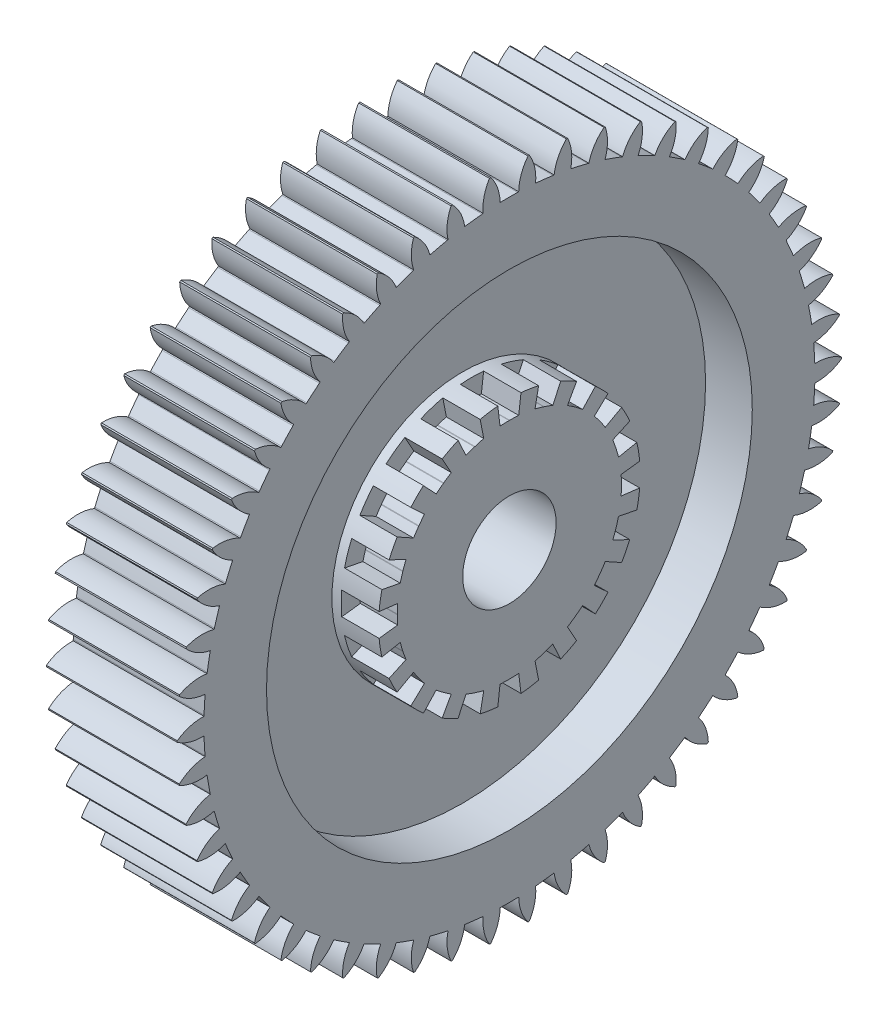
from build123d import *

# Parameters (mm, degrees)
SKETCH1_R                = 177.8
BOSS_EXTRUDE1_DEPTH      = 35
SKETCH2_R                = 25
CUT_EXTRUDE1_DEPTH       = 262.008965363
SKETCH3_R                = 130
SKETCH3_R_2              = 70
CUT_EXTRUDE2_DEPTH       = 25
CUT_EXTRUDE3_DEPTH       = 262.008965363
FILLET1_R                = 290
CIRPATTERN2_COUNT        = 54
FILLET1_OF_CIRPATTERN2_R = 290
CUT_EXTRUDE4_DEPTH       = 20
FILLET2_R                = 70
CIRPATTERN3_START        = 15
CIRPATTERN3_DEPTH        = 20


# Read off the part's stored shape, not the designer's step: CirPattern3
with BuildPart() as part:
    # Sketch1 → Boss-Extrude1 (new, symmetric)
    with BuildSketch(Plane(origin=(0, 0, 0), x_dir=(0, 0, -1), z_dir=(1, 0, 0))):
        Circle(SKETCH1_R)
    extrude(amount=BOSS_EXTRUDE1_DEPTH, both=True)

    # Sketch2 → Cut-Extrude1 (cut, through all)
    with BuildSketch(Plane(origin=(35, 0, 0), x_dir=(0, 0, -1), z_dir=(1, 0, 0))):
        Circle(SKETCH2_R)
    extrude(amount=-CUT_EXTRUDE1_DEPTH, mode=Mode.SUBTRACT)

    # Sketch3 → Cut-Extrude2 (cut)
    with BuildSketch(Plane(origin=(35, 0, 0), x_dir=(0, 0, -1), z_dir=(1, 0, 0))):
        Circle(SKETCH3_R)
        Circle(SKETCH3_R_2, mode=Mode.SUBTRACT)
    extrude(amount=-CUT_EXTRUDE2_DEPTH, mode=Mode.SUBTRACT)

    # Sketch5 → Cut-Extrude3 (cut, through all)
    with BuildSketch(Plane(origin=(35, 0, 0), x_dir=(0, 0, -1), z_dir=(1, 0, 0))):
        with BuildLine():
            Line((0, 163.515), (-4.985, 163.438994735))
            ThreePointArc((-4.985, 163.438994735), (-6.324568609, 170.888942334), (-9.975, 177.519968947))
            Line((-9.975, 177.519968947), (0, 181.540723368))
            Line((0, 181.540723368), (9.975, 177.519968947))
            ThreePointArc((9.975, 177.519968947), (6.324568609, 170.888942334), (4.985, 163.438994735))
            Line((4.985, 163.438994735), (0, 163.515))
        make_face()
    cut_extrude3 = extrude(amount=-CUT_EXTRUDE3_DEPTH, mode=Mode.SUBTRACT)

    # Fillet1
    # the kernel refuses this fillet: 290 mm, written as the material it takes off along each edge
    with BuildSketch(Plane(origin=(46.053925195, 163.515, 0), x_dir=(0, -0.015245021510603718, 0.9998837879069453), z_dir=(-1, 0, 0))) as fillet1_piece_1:
        with BuildLine():
            CenterArc((FILLET1_R * 0.0152467933724, -FILLET1_R), FILLET1_R, 90, 1.747018458)
            Line((-FILLET1_R * 0.0152397063371, -FILLET1_R * 0.000464821361718), (0, 0))
            Line((0, 0), (FILLET1_R * 0.0152467933724, 0))
        make_face()
    extrude(amount=92.10785039, mode=Mode.SUBTRACT)

    # CirPattern2: Cut-Extrude3 ×54 about axis
    cirpattern2_axis = Axis((0, 0, 0), (1, 0, 0))
    for i in range(1, CIRPATTERN2_COUNT):
        add(cut_extrude3.rotate(cirpattern2_axis, i * 360 / CIRPATTERN2_COUNT), mode=Mode.SUBTRACT)

    # Fillet1 of CirPattern2
    # the kernel refuses this fillet: 290 mm, written as the material it takes off along each edge
    with BuildSketch(Plane(origin=(46.053925195, 162.409370066, 18.982932853), x_dir=(0, -0.13122136285363895, 0.9913530924604178), z_dir=(-1, 0, 0)), Plane(origin=(46.053925195, 159.107432013, 37.709154104), x_dir=(0, -0.24542316037219167, 0.96941604708862), z_dir=(-1, 0, 0)), Plane(origin=(46.053925195, 153.653838888, 55.925423736), x_dir=(0, -0.35630603066617983, 0.9343693126975603), z_dir=(-1, 0, 0)), Plane(origin=(46.053925195, 146.122341182, 73.38539795), x_dir=(0, -0.4623704731326896, 0.8866868362477547), z_dir=(-1, 0, 0)), Plane(origin=(46.053925195, 136.614789483, 89.852960549), x_dir=(0, -0.56218214813916, 0.8270134414346841), z_dir=(-1, 0, 0)), Plane(origin=(46.053925195, 125.259757117, 105.105415998), x_dir=(0, -0.654391274006467, 0.7561561085544392), z_dir=(-1, 0, 0)), Plane(origin=(46.053925195, 112.210801416, 118.936501002), x_dir=(0, -0.7377508804905187, 0.6750730614796182), z_dir=(-1, 0, 0)), Plane(origin=(46.053925195, 97.644387122, 131.159173863), x_dir=(0, -0.8111336719156741, 0.5848608093252579), z_dir=(-1, 0, 0)), Plane(origin=(46.053925195, 81.7575, 141.6081439), x_dir=(0, -0.8735472719149304, 0.4867393180440454), z_dir=(-1, 0, 0)), Plane(origin=(46.053925195, 64.764982944, 150.142106717), x_dir=(0, -0.9241476436178044, 0.3820355124797425), z_dir=(-1, 0, 0)), Plane(origin=(46.053925195, 46.896630597, 156.645655106), x_dir=(0, -0.9622505038011333, 0.27216533198492643), z_dir=(-1, 0, 0)), Plane(origin=(46.053925195, 28.394081771, 161.030839734), x_dir=(0, -0.9873405766457838, 0.15861458227026645), z_dir=(-1, 0, 0)), Plane(origin=(46.053925195, 9.507551699, 163.2383585), x_dir=(0, -0.9990785619581524, 0.042918842431153646), z_dir=(-1, 0, 0)), Plane(origin=(46.053925195, -9.507551699, 163.2383585), x_dir=(0, -0.9973057236232107, -0.07335730112527596), z_dir=(-1, 0, 0)), Plane(origin=(46.053925195, -28.394081771, 161.030839734), x_dir=(0, -0.9820460362381654, -0.18864141302722456), z_dir=(-1, 0, 0)), Plane(origin=(46.053925195, -46.896630597, 156.645655106), x_dir=(0, -0.9535058608971471, -0.30137447342930435), z_dir=(-1, 0, 0)), Plane(origin=(46.053925195, -64.764982944, 150.142106717), x_dir=(0, -0.9120711545114353, -0.4100319610813011), z_dir=(-1, 0, 0)), Plane(origin=(46.053925195, -81.7575, 141.6081439), x_dir=(0, -0.8583022504043238, -0.5131444698628969), z_dir=(-1, 0, 0)), Plane(origin=(46.053925195, -97.644387122, 131.159173863), x_dir=(0, -0.7929262807641754, -0.6093175799806633), z_dir=(-1, 0, 0)), Plane(origin=(46.053925195, -112.210801416, 118.936501002), x_dir=(0, -0.7168273434289478, -0.6972507151036831), z_dir=(-1, 0, 0)), Plane(origin=(46.053925195, -125.259757117, 105.105415998), x_dir=(0, -0.6310345459795956, -0.7757547304272954), z_dir=(-1, 0, 0)), Plane(origin=(46.053925195, -136.614789483, 89.852960549), x_dir=(0, -0.5367080888254764, -0.8437679938166087), z_dir=(-1, 0, 0)), Plane(origin=(46.053925195, -146.122341182, 73.38539795), x_dir=(0, -0.43512357548404884, -0.9003707425599617), z_dir=(-1, 0, 0)), Plane(origin=(46.053925195, -153.653838888, 55.925423736), x_dir=(0, -0.32765476223169554, -0.9447975215816833), z_dir=(-1, 0, 0)), Plane(origin=(46.053925195, -159.107432013, 37.709154104), x_dir=(0, -0.21575498040662372, -0.9764475349089358), z_dir=(-1, 0, 0)), Plane(origin=(46.053925195, -162.409370066, 18.982932853), x_dir=(0, -0.10093748259576409, -0.9948927704065548), z_dir=(-1, 0, 0)), Plane(origin=(46.053925195, -163.515, 0), x_dir=(0, 0.015245021510603718, -0.9998837879069453), z_dir=(-1, 0, 0)), Plane(origin=(46.053925195, -162.409370066, -18.982932853), x_dir=(0, 0.13122136285362598, -0.9913530924604195), z_dir=(-1, 0, 0)), Plane(origin=(46.053925195, -159.107432013, -37.709154104), x_dir=(0, 0.24542316037219247, -0.9694160470886198), z_dir=(-1, 0, 0)), Plane(origin=(46.053925195, -153.653838888, -55.925423736), x_dir=(0, 0.35630603066619776, -0.9343693126975535), z_dir=(-1, 0, 0)), Plane(origin=(46.053925195, -146.122341182, -73.38539795), x_dir=(0, 0.46237047313267954, -0.88668683624776), z_dir=(-1, 0, 0)), Plane(origin=(46.053925195, -136.614789483, -89.852960549), x_dir=(0, 0.5621821481391615, -0.827013441434683), z_dir=(-1, 0, 0)), Plane(origin=(46.053925195, -125.259757117, -105.105415998), x_dir=(0, 0.6543912740064689, -0.7561561085544377), z_dir=(-1, 0, 0)), Plane(origin=(46.053925195, -112.210801416, -118.936501002), x_dir=(0, 0.7377508804905157, -0.6750730614796213), z_dir=(-1, 0, 0)), Plane(origin=(46.053925195, -97.644387122, -131.159173863), x_dir=(0, 0.8111336719156761, -0.5848608093252552), z_dir=(-1, 0, 0)), Plane(origin=(46.053925195, -81.7575, -141.6081439), x_dir=(0, 0.8735472719149361, -0.4867393180440357), z_dir=(-1, 0, 0)), Plane(origin=(46.053925195, -64.764982944, -150.142106717), x_dir=(0, 0.9241476436178044, -0.3820355124797425), z_dir=(-1, 0, 0)), Plane(origin=(46.053925195, -46.896630597, -156.645655106), x_dir=(0, 0.9622505038011331, -0.2721653319849268), z_dir=(-1, 0, 0)), Plane(origin=(46.053925195, -28.394081771, -161.030839734), x_dir=(0, 0.9873405766457838, -0.15861458227026634), z_dir=(-1, 0, 0)), Plane(origin=(46.053925195, -9.507551699, -163.2383585), x_dir=(0, 0.9990785619581529, -0.04291884243114078), z_dir=(-1, 0, 0)), Plane(origin=(46.053925195, 9.507551699, -163.2383585), x_dir=(0, 0.9973057236232105, 0.073357301125276), z_dir=(-1, 0, 0)), Plane(origin=(46.053925195, 28.394081771, -161.030839734), x_dir=(0, 0.9820460362381617, 0.18864141302724374), z_dir=(-1, 0, 0)), Plane(origin=(46.053925195, 46.896630597, -156.645655106), x_dir=(0, 0.9535058608971471, 0.30137447342930435), z_dir=(-1, 0, 0)), Plane(origin=(46.053925195, 64.764982944, -150.142106717), x_dir=(0, 0.9120711545114353, 0.4100319610813011), z_dir=(-1, 0, 0)), Plane(origin=(46.053925195, 81.7575, -141.6081439), x_dir=(0, 0.8583022504043184, 0.5131444698629057), z_dir=(-1, 0, 0)), Plane(origin=(46.053925195, 97.644387122, -131.159173863), x_dir=(0, 0.7929262807641698, 0.6093175799806705), z_dir=(-1, 0, 0)), Plane(origin=(46.053925195, 112.210801416, -118.936501002), x_dir=(0, 0.7168273434289478, 0.6972507151036831), z_dir=(-1, 0, 0)), Plane(origin=(46.053925195, 125.259757117, -105.105415998), x_dir=(0, 0.6310345459796027, 0.7757547304272897), z_dir=(-1, 0, 0)), Plane(origin=(46.053925195, 136.614789483, -89.852960549), x_dir=(0, 0.5367080888254628, 0.8437679938166173), z_dir=(-1, 0, 0)), Plane(origin=(46.053925195, 146.122341182, -73.38539795), x_dir=(0, 0.4351235754840476, 0.9003707425599624), z_dir=(-1, 0, 0)), Plane(origin=(46.053925195, 153.653838888, -55.925423736), x_dir=(0, 0.3276547622316945, 0.9447975215816834), z_dir=(-1, 0, 0)), Plane(origin=(46.053925195, 159.107432013, -37.709154104), x_dir=(0, 0.21575498040662336, 0.9764475349089358), z_dir=(-1, 0, 0)), Plane(origin=(46.053925195, 162.409370066, -18.982932853), x_dir=(0, 0.10093748259574493, 0.9948927704065568), z_dir=(-1, 0, 0))) as fillet1_of_cirpattern2_piece_1:
        with BuildLine():
            CenterArc((FILLET1_OF_CIRPATTERN2_R * 0.0152467933724, -FILLET1_OF_CIRPATTERN2_R), FILLET1_OF_CIRPATTERN2_R, 90, 1.747018458)
            Line((-FILLET1_OF_CIRPATTERN2_R * 0.0152397063371, -FILLET1_OF_CIRPATTERN2_R * 0.000464821361718), (0, 0))
            Line((0, 0), (FILLET1_OF_CIRPATTERN2_R * 0.0152467933724, 0))
        make_face()
    extrude(amount=92.10785039, mode=Mode.SUBTRACT)

    # Sketch6 → Cut-Extrude4 (cut)
    with BuildSketch(Plane(origin=(35, 0, 0), x_dir=(0, 0, -1), z_dir=(1, 0, 0))):
        Polygon((0, 59.961257305), (-3.387218626, 59.961257305), (-5, 59.791303716), (-9.571256192, 97.377400695), (9.571256192, 97.377400695), (5, 59.791303716), (3.387218626, 59.961257305), align=None)
    extrude(amount=-CUT_EXTRUDE4_DEPTH, mode=Mode.SUBTRACT)

    # Fillet2
    # the kernel refuses this fillet: 70 mm, written as the material it takes off along each edge
    with BuildSketch(Plane(origin=(43.155288445, 59.961257305, 3.387218626), x_dir=(0, -0.1047989093165836, 0.9944934331638668), z_dir=(-1, 0, 0))) as fillet2_piece_1:
        with BuildLine():
            CenterArc((4.091771331, -69.956406455), FILLET2_R, 92.022191331, 3.993389662)
            Line((-3.244152322, -0.341866134), (-3.390870795, 1.050424673))
            Line((-3.390870795, 1.050424673), (-0.146718473, 1.392290806))
            Line((-0.146718473, 1.392290806), (0, 1.4))
            ThreePointArc((0, 1.4), (0.810855718, 1.4), (1.572310238, 1.399128129))
            Line((1.572310238, 1.399128129), (1.621711436, 0))
        make_face()
    extrude(amount=28.155288445, mode=Mode.SUBTRACT)
    with BuildSketch(Plane(origin=(43.155288445, 59.961257305, -3.387218626), x_dir=(0, 0, 1), z_dir=(-1, 0, 0))) as fillet2_piece_2:
        with BuildLine():
            CenterArc((3.262115378, -70), FILLET2_R, 90, 3.993389662)
            Line((-1.612781374, -0.16995359), (-1.710279309, 1.226647338))
            ThreePointArc((-1.710279309, 1.226647338), (-0.95310916, 1.307314012), (-0.146718473, 1.392290806))
            Line((-0.146718473, 1.392290806), (0, 1.4))
            Line((0, 1.4), (3.262115378, 1.4))
            Line((3.262115378, 1.4), (3.262115378, 0))
        make_face()
    extrude(amount=28.155288445, mode=Mode.SUBTRACT)

    # CirPattern3 outline → CirPattern3 (cut)
    with BuildSketch(Plane.YZ.offset(CIRPATTERN3_START)):
        with BuildLine():
            ThreePointArc((55.319824045, 23.231811545), (56.193793746, 20.954453655), (56.987885455, 18.648027771))
            Line((56.987885455, 18.648027771), (57.065203515, 18.410067252))
            ThreePointArc((57.065203515, 18.410067252), (57.778452948, 16.07737412), (58.409993988, 13.721246382))
            Line((58.409993988, 13.721246382), (68.23001958, 15.641752718))
            ThreePointArc((68.23001958, 15.641752718), (66.573956141, 21.631189606), (64.393236935, 27.450155502))
            Line((64.393236935, 27.450155502), (55.319824045, 23.231811545))
        make_face()
        with BuildLine():
            Line((51.311107083, 31.099361567), (60.057037317, 35.960426426))
            ThreePointArc((60.057037317, 35.960426426), (56.631189606, 41.14496766), (52.759043044, 46.005253799))
            Line((52.759043044, 46.005253799), (45.43325456, 39.189531511))
            ThreePointArc((45.43325456, 39.189531511), (46.968191431, 37.29370694), (48.436142319, 35.345553407))
            Line((48.436142319, 35.345553407), (48.583210009, 35.143132099))
            ThreePointArc((48.583210009, 35.143132099), (49.982392349, 33.145015291), (51.311107083, 31.099361567))
        make_face()
        with BuildLine():
            ThreePointArc((64.393236935, -27.450155502), (66.573956141, -21.631189606), (68.23001958, -15.641752718))
            Line((68.23001958, -15.641752718), (58.409993988, -13.721246382))
            ThreePointArc((58.409993988, -13.721246382), (57.778452948, -16.07737412), (57.065203515, -18.410067252))
            Line((57.065203515, -18.410067252), (56.987885455, -18.648027771))
            ThreePointArc((56.987885455, -18.648027771), (56.193793746, -20.954453655), (55.319824045, -23.231811545))
            Line((55.319824045, -23.231811545), (64.393236935, -27.450155502))
        make_face()
        with BuildLine():
            Line((39.189531511, 45.43325456), (46.005253799, 52.759043044))
            ThreePointArc((46.005253799, 52.759043044), (41.14496766, 56.631189606), (35.960426426, 60.057037317))
            Line((35.960426426, 60.057037317), (31.099361567, 51.311107083))
            ThreePointArc((31.099361567, 51.311107083), (33.145015291, 49.982392349), (35.143132099, 48.583210009))
            Line((35.143132099, 48.583210009), (35.345553407, 48.436142319))
            ThreePointArc((35.345553407, 48.436142319), (37.29370694, 46.968191431), (39.189531511, 45.43325456))
        make_face()
        with BuildLine():
            ThreePointArc((52.759043044, -46.005253799), (56.631189606, -41.14496766), (60.057037317, -35.960426426))
            Line((60.057037317, -35.960426426), (51.311107083, -31.099361567))
            ThreePointArc((51.311107083, -31.099361567), (49.982392349, -33.145015291), (48.583210009, -35.143132099))
            Line((48.583210009, -35.143132099), (48.436142319, -35.345553407))
            ThreePointArc((48.436142319, -35.345553407), (46.968191431, -37.29370694), (45.43325456, -39.189531511))
            Line((45.43325456, -39.189531511), (52.759043044, -46.005253799))
        make_face()
        with BuildLine():
            Line((23.231811545, 55.319824045), (27.450155502, 64.393236935))
            ThreePointArc((27.450155502, 64.393236935), (21.631189606, 66.573956141), (15.641752718, 68.23001958))
            Line((15.641752718, 68.23001958), (13.721246382, 58.409993988))
            ThreePointArc((13.721246382, 58.409993988), (16.07737412, 57.778452948), (18.410067252, 57.065203515))
            Line((18.410067252, 57.065203515), (18.648027771, 56.987885455))
            ThreePointArc((18.648027771, 56.987885455), (20.954453655, 56.193793746), (23.231811545, 55.319824045))
        make_face()
        with BuildLine():
            ThreePointArc((35.960426426, -60.057037317), (41.14496766, -56.631189606), (46.005253799, -52.759043044))
            Line((46.005253799, -52.759043044), (39.189531511, -45.43325456))
            ThreePointArc((39.189531511, -45.43325456), (37.29370694, -46.968191431), (35.345553407, -48.436142319))
            Line((35.345553407, -48.436142319), (35.143132099, -48.583210009))
            ThreePointArc((35.143132099, -48.583210009), (33.145015291, -49.982392349), (31.099361567, -51.311107083))
            Line((31.099361567, -51.311107083), (35.960426426, -60.057037317))
        make_face()
        with BuildLine():
            Line((5, 59.791303716), (6.208044728, 69.72417214))
            ThreePointArc((6.208044728, 69.72417214), (0, 70), (-6.208044728, 69.72417214))
            Line((-6.208044728, 69.72417214), (-5, 59.791303716))
            ThreePointArc((-5, 59.791303716), (-2.564032448, 59.918756005), (-0.125103249, 59.961257305))
            Line((-0.125103249, 59.961257305), (0.125103249, 59.961257305))
            ThreePointArc((0.125103249, 59.961257305), (2.564032448, 59.918756005), (5, 59.791303716))
        make_face()
        with BuildLine():
            ThreePointArc((15.641752718, -68.23001958), (21.631189606, -66.573956141), (27.450155502, -64.393236935))
            Line((27.450155502, -64.393236935), (23.231811545, -55.319824045))
            ThreePointArc((23.231811545, -55.319824045), (20.954453655, -56.193793746), (18.648027771, -56.987885455))
            Line((18.648027771, -56.987885455), (18.410067252, -57.065203515))
            ThreePointArc((18.410067252, -57.065203515), (16.07737412, -57.778452948), (13.721246382, -58.409993988))
            Line((13.721246382, -58.409993988), (15.641752718, -68.23001958))
        make_face()
        with BuildLine():
            Line((-13.721246382, 58.409993988), (-15.641752718, 68.23001958))
            ThreePointArc((-15.641752718, 68.23001958), (-21.631189606, 66.573956141), (-27.450155502, 64.393236935))
            Line((-27.450155502, 64.393236935), (-23.231811545, 55.319824045))
            ThreePointArc((-23.231811545, 55.319824045), (-20.954453655, 56.193793746), (-18.648027771, 56.987885455))
            Line((-18.648027771, 56.987885455), (-18.410067252, 57.065203515))
            ThreePointArc((-18.410067252, 57.065203515), (-16.07737412, 57.778452948), (-13.721246382, 58.409993988))
        make_face()
        with BuildLine():
            ThreePointArc((-6.208044728, -69.72417214), (0, -70), (6.208044728, -69.72417214))
            Line((6.208044728, -69.72417214), (5, -59.791303716))
            ThreePointArc((5, -59.791303716), (2.564032448, -59.918756005), (0.125103249, -59.961257305))
            Line((0.125103249, -59.961257305), (-0.125103249, -59.961257305))
            ThreePointArc((-0.125103249, -59.961257305), (-2.564032448, -59.918756005), (-5, -59.791303716))
            Line((-5, -59.791303716), (-6.208044728, -69.72417214))
        make_face()
        with BuildLine():
            Line((-31.099361567, 51.311107083), (-35.960426426, 60.057037317))
            ThreePointArc((-35.960426426, 60.057037317), (-41.14496766, 56.631189606), (-46.005253799, 52.759043044))
            Line((-46.005253799, 52.759043044), (-39.189531511, 45.43325456))
            ThreePointArc((-39.189531511, 45.43325456), (-37.29370694, 46.968191431), (-35.345553407, 48.436142319))
            Line((-35.345553407, 48.436142319), (-35.143132099, 48.583210009))
            ThreePointArc((-35.143132099, 48.583210009), (-33.145015291, 49.982392349), (-31.099361567, 51.311107083))
        make_face()
        with BuildLine():
            ThreePointArc((-27.450155502, -64.393236935), (-21.631189606, -66.573956141), (-15.641752718, -68.23001958))
            Line((-15.641752718, -68.23001958), (-13.721246382, -58.409993988))
            ThreePointArc((-13.721246382, -58.409993988), (-16.07737412, -57.778452948), (-18.410067252, -57.065203515))
            Line((-18.410067252, -57.065203515), (-18.648027771, -56.987885455))
            ThreePointArc((-18.648027771, -56.987885455), (-20.954453655, -56.193793746), (-23.231811545, -55.319824045))
            Line((-23.231811545, -55.319824045), (-27.450155502, -64.393236935))
        make_face()
        with BuildLine():
            Line((-45.43325456, 39.189531511), (-52.759043044, 46.005253799))
            ThreePointArc((-52.759043044, 46.005253799), (-56.631189606, 41.14496766), (-60.057037317, 35.960426426))
            Line((-60.057037317, 35.960426426), (-51.311107083, 31.099361567))
            ThreePointArc((-51.311107083, 31.099361567), (-49.982392349, 33.145015291), (-48.583210009, 35.143132099))
            Line((-48.583210009, 35.143132099), (-48.436142319, 35.345553407))
            ThreePointArc((-48.436142319, 35.345553407), (-46.968191431, 37.29370694), (-45.43325456, 39.189531511))
        make_face()
        with BuildLine():
            ThreePointArc((-46.005253799, -52.759043044), (-41.14496766, -56.631189606), (-35.960426426, -60.057037317))
            Line((-35.960426426, -60.057037317), (-31.099361567, -51.311107083))
            ThreePointArc((-31.099361567, -51.311107083), (-33.145015291, -49.982392349), (-35.143132099, -48.583210009))
            Line((-35.143132099, -48.583210009), (-35.345553407, -48.436142319))
            ThreePointArc((-35.345553407, -48.436142319), (-37.29370694, -46.968191431), (-39.189531511, -45.43325456))
            Line((-39.189531511, -45.43325456), (-46.005253799, -52.759043044))
        make_face()
        with BuildLine():
            Line((-55.319824045, 23.231811545), (-64.393236935, 27.450155502))
            ThreePointArc((-64.393236935, 27.450155502), (-66.573956141, 21.631189606), (-68.23001958, 15.641752718))
            Line((-68.23001958, 15.641752718), (-58.409993988, 13.721246382))
            ThreePointArc((-58.409993988, 13.721246382), (-57.778452948, 16.07737412), (-57.065203515, 18.410067252))
            Line((-57.065203515, 18.410067252), (-56.987885455, 18.648027771))
            ThreePointArc((-56.987885455, 18.648027771), (-56.193793746, 20.954453655), (-55.319824045, 23.231811545))
        make_face()
        with BuildLine():
            ThreePointArc((-60.057037317, -35.960426426), (-56.631189606, -41.14496766), (-52.759043044, -46.005253799))
            Line((-52.759043044, -46.005253799), (-45.43325456, -39.189531511))
            ThreePointArc((-45.43325456, -39.189531511), (-46.968191431, -37.29370694), (-48.436142319, -35.345553407))
            Line((-48.436142319, -35.345553407), (-48.583210009, -35.143132099))
            ThreePointArc((-48.583210009, -35.143132099), (-49.982392349, -33.145015291), (-51.311107083, -31.099361567))
            Line((-51.311107083, -31.099361567), (-60.057037317, -35.960426426))
        make_face()
        with BuildLine():
            Line((-59.791303716, 5), (-69.72417214, 6.208044728))
            ThreePointArc((-69.72417214, 6.208044728), (-70, 0), (-69.72417214, -6.208044728))
            Line((-69.72417214, -6.208044728), (-59.791303716, -5))
            ThreePointArc((-59.791303716, -5), (-59.918756005, -2.564032448), (-59.961257305, -0.125103249))
            Line((-59.961257305, -0.125103249), (-59.961257305, 0.125103249))
            ThreePointArc((-59.961257305, 0.125103249), (-59.918756005, 2.564032448), (-59.791303716, 5))
        make_face()
        with BuildLine():
            ThreePointArc((-68.23001958, -15.641752718), (-66.573956141, -21.631189606), (-64.393236935, -27.450155502))
            Line((-64.393236935, -27.450155502), (-55.319824045, -23.231811545))
            ThreePointArc((-55.319824045, -23.231811545), (-56.193793746, -20.954453655), (-56.987885455, -18.648027771))
            Line((-56.987885455, -18.648027771), (-57.065203515, -18.410067252))
            ThreePointArc((-57.065203515, -18.410067252), (-57.778452948, -16.07737412), (-58.409993988, -13.721246382))
            Line((-58.409993988, -13.721246382), (-68.23001958, -15.641752718))
        make_face()
    extrude(amount=CIRPATTERN3_DEPTH, mode=Mode.SUBTRACT)


solid = part.part
